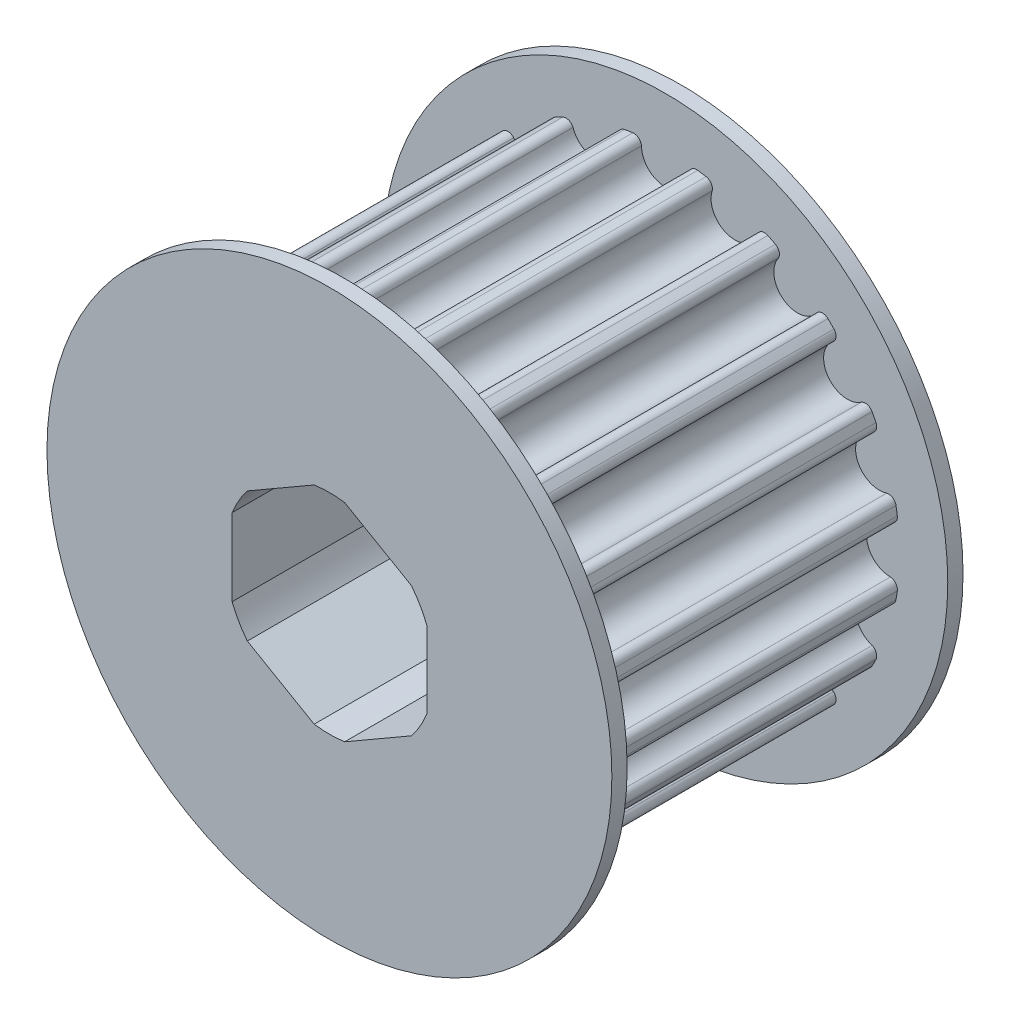
from build123d import *

# Parameters (mm, degrees)
SKETCH2_R                = 15.343994309
BOSS_EXTRUDE1_DEPTH      = 21
CUT_EXTRUDE1_DEPTH       = 31.19728999
FILLET1_R                = 0.5
CIRPATTERN1_COUNT        = 20
FILLET1_OF_CIRPATTERN1_R = 0.5
CUT_EXTRUDE2_DEPTH       = 31.051908029
SKETCH7_R                = 18.5
BOSS_EXTRUDE2_DEPTH      = 1


with BuildPart() as part:
    # Sketch2 → Boss-Extrude1 (new body)
    with BuildSketch(Plane.XY):
        Circle(SKETCH2_R)
    extrude(amount=BOSS_EXTRUDE1_DEPTH)

    # Sketch3 → Cut-Extrude1 (cut, through all)
    with BuildSketch(Plane(origin=(0, 0, 0), x_dir=(-1, 0, 0), z_dir=(0, 0, -1))):
        with BuildLine():
            Line((-1.614471729, 15.258821789), (-1.56, 14.743994309))
            ThreePointArc((-1.56, 14.743994309), (0, 13.183994309), (1.56, 14.743994309))
            Line((1.56, 14.743994309), (1.614471729, 15.258821789))
            ThreePointArc((1.614471729, 15.258821789), (0, 15.343994309), (-1.614471729, 15.258821789))
        make_face()
    cut_extrude1 = extrude(amount=-CUT_EXTRUDE1_DEPTH, mode=Mode.SUBTRACT)

    # Fillet1
    fillet1_edges = [part.edges().sort_by_distance(p)[0] for p in [
        (-1.614471729, 15.258821789, 10.5),
        (1.614471729, 15.258821789, 10.5),
    ]]
    fillet(fillet1_edges, radius=FILLET1_R)

    # CirPattern1: Cut-Extrude1 ×20 about axis
    cirpattern1_axis = Axis((0, 0, 0), (0, 0, 1))
    for i in range(1, CIRPATTERN1_COUNT):
        add(cut_extrude1.rotate(cirpattern1_axis, i * 360 / CIRPATTERN1_COUNT), mode=Mode.SUBTRACT)

    # Fillet1 of CirPattern1
    fillet1_of_cirpattern1_edges = [part.edges().sort_by_distance(p)[0] for p in [
        (-6.250689106, 14.013102692, 10.5),
        (-3.179781388, 15.010901095, 10.5),
        (-10.275045481, 11.395683469, 10.5),
        (-7.662775349, 13.293608814, 10.5),
        (-13.293608814, 7.662775349, 10.5),
        (-11.395683469, 10.275045481, 10.5),
        (-15.010901095, 3.179781388, 10.5),
        (-14.013102692, 6.250689106, 10.5),
        (-15.258821789, -1.614471729, 10.5),
        (-15.258821789, 1.614471729, 10.5),
        (-14.013102692, -6.250689106, 10.5),
        (-15.010901095, -3.179781388, 10.5),
        (-11.395683469, -10.275045481, 10.5),
        (-13.293608814, -7.662775349, 10.5),
        (-7.662775349, -13.293608814, 10.5),
        (-10.275045481, -11.395683469, 10.5),
        (-3.179781388, -15.010901095, 10.5),
        (-6.250689106, -14.013102692, 10.5),
        (1.614471729, -15.258821789, 10.5),
        (-1.614471729, -15.258821789, 10.5),
        (6.250689106, -14.013102692, 10.5),
        (3.179781388, -15.010901095, 10.5),
        (10.275045481, -11.395683469, 10.5),
        (7.662775349, -13.293608814, 10.5),
        (13.293608814, -7.662775349, 10.5),
        (11.395683469, -10.275045481, 10.5),
        (15.010901095, -3.179781388, 10.5),
        (14.013102692, -6.250689106, 10.5),
        (15.258821789, 1.614471729, 10.5),
        (15.258821789, -1.614471729, 10.5),
        (14.013102692, 6.250689106, 10.5),
        (15.010901095, 3.179781388, 10.5),
        (11.395683469, 10.275045481, 10.5),
        (13.293608814, 7.662775349, 10.5),
        (7.662775349, 13.293608814, 10.5),
        (10.275045481, 11.395683469, 10.5),
        (3.179781388, 15.010901095, 10.5),
        (6.250689106, 14.013102692, 10.5),
    ]]
    fillet(fillet1_of_cirpattern1_edges, radius=FILLET1_OF_CIRPATTERN1_R)

    # Sketch5 → Cut-Extrude2 (cut, through all)
    with BuildSketch(Plane(origin=(0, 0, 0), x_dir=(-1, 0, 0), z_dir=(0, 0, -1))):
        with BuildLine():
            ThreePointArc((-0.999132174, -6.784828583), (0, -6.858), (0.999132174, -6.784828583))
            Line((0.999132174, -6.784828583), (5.376267826, -4.257688136))
            ThreePointArc((5.376267826, -4.257688136), (5.939202219, -3.429), (6.3754, -2.527140447))
            Line((6.3754, -2.527140447), (6.3754, 2.527140447))
            ThreePointArc((6.3754, 2.527140447), (5.939202219, 3.429), (5.376267826, 4.257688136))
            Line((5.376267826, 4.257688136), (0.999132174, 6.784828583))
            ThreePointArc((0.999132174, 6.784828583), (0, 6.858), (-0.999132174, 6.784828583))
            Line((-0.999132174, 6.784828583), (-5.376267826, 4.257688136))
            ThreePointArc((-5.376267826, 4.257688136), (-5.939202219, 3.429), (-6.3754, 2.527140447))
            Line((-6.3754, 2.527140447), (-6.3754, -2.527140447))
            ThreePointArc((-6.3754, -2.527140447), (-5.939202219, -3.429), (-5.376267826, -4.257688136))
            Line((-5.376267826, -4.257688136), (-0.999132174, -6.784828583))
        make_face()
    extrude(amount=-CUT_EXTRUDE2_DEPTH, mode=Mode.SUBTRACT)

    # Sketch7 → Boss-Extrude2 (add)
    with BuildSketch(Plane.XY.offset(21)):
        Circle(SKETCH7_R)
        with BuildLine():
            Line((6.3754, -2.527140447), (6.3754, 2.527140447))
            ThreePointArc((6.3754, 2.527140447), (5.939202219, 3.429), (5.376267826, 4.257688136))
            Line((5.376267826, 4.257688136), (0.999132174, 6.784828583))
            ThreePointArc((0.999132174, 6.784828583), (0, 6.858), (-0.999132174, 6.784828583))
            Line((-0.999132174, 6.784828583), (-5.376267826, 4.257688136))
            ThreePointArc((-5.376267826, 4.257688136), (-5.939202219, 3.429), (-6.3754, 2.527140447))
            Line((-6.3754, 2.527140447), (-6.3754, -2.527140447))
            ThreePointArc((-6.3754, -2.527140447), (-5.939202219, -3.429), (-5.376267826, -4.257688136))
            Line((-5.376267826, -4.257688136), (-0.999132174, -6.784828583))
            ThreePointArc((-0.999132174, -6.784828583), (0, -6.858), (0.999132174, -6.784828583))
            Line((0.999132174, -6.784828583), (5.376267826, -4.257688136))
            ThreePointArc((5.376267826, -4.257688136), (5.939202219, -3.429), (6.3754, -2.527140447))
        make_face(mode=Mode.SUBTRACT)
    boss_extrude2 = extrude(amount=BOSS_EXTRUDE2_DEPTH)

    # Mirror1: Boss-Extrude2 across plane
    add(boss_extrude2.mirror(Plane.XY.offset(10.5)))


solid = part.part
